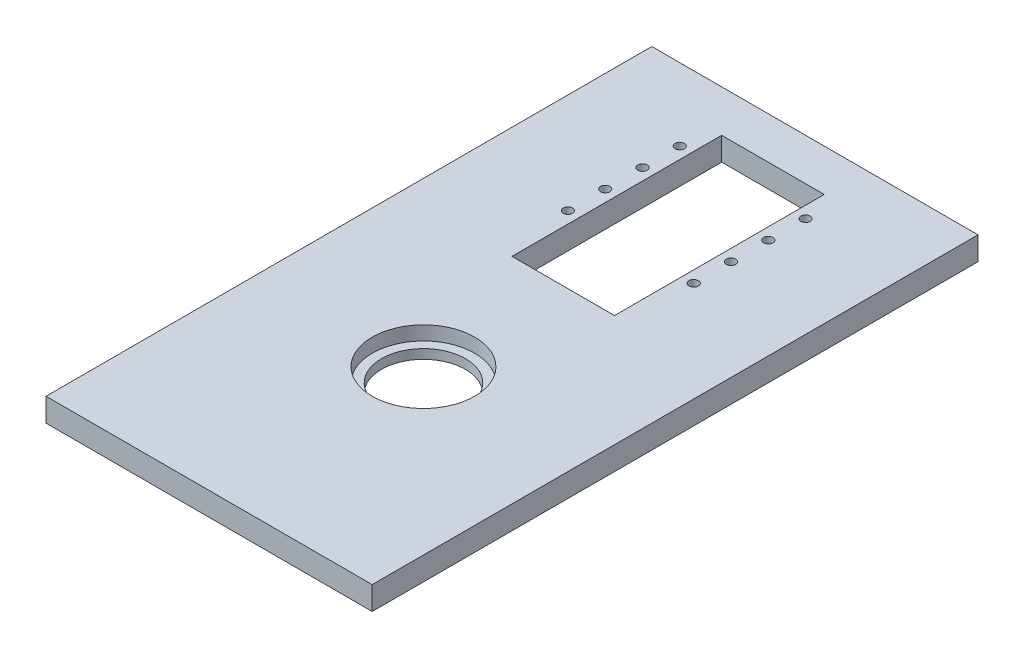
from build123d import *

# Parameters (mm, degrees)
SKETCH3_W           = 70
SKETCH3_H           = 130
SKETCH3_R           = 1
SKETCH3_R_2         = 9
SKETCH3_W_2         = 22
SKETCH3_H_2         = 45
BOSS_EXTRUDE1_DEPTH = 5
SKETCH4_R           = 11
CUT_EXTRUDE3_DEPTH  = 3


with BuildPart() as part:
    # Sketch3 → Boss-Extrude1 (new body)
    with BuildSketch(Plane(origin=(0, 0, 0), x_dir=(1, 0, 0), z_dir=(0, 1, 0))):
        with Locations((0, 19)):
            Rectangle(SKETCH3_W, SKETCH3_H)
        with Locations((-13.5, 60.5)):
            Circle(SKETCH3_R, mode=Mode.SUBTRACT)
        with Locations((13.5, 60.5)):
            Circle(SKETCH3_R, mode=Mode.SUBTRACT)
        with Locations((-13.5, 52.5)):
            Circle(SKETCH3_R, mode=Mode.SUBTRACT)
        with Locations((-13.5, 44.5)):
            Circle(SKETCH3_R, mode=Mode.SUBTRACT)
        with Locations((13.5, 52.5)):
            Circle(SKETCH3_R, mode=Mode.SUBTRACT)
        with Locations((13.5, 44.5)):
            Circle(SKETCH3_R, mode=Mode.SUBTRACT)
        with Locations((-13.5, 68.5)):
            Circle(SKETCH3_R, mode=Mode.SUBTRACT)
        with Locations((13.5, 68.5)):
            Circle(SKETCH3_R, mode=Mode.SUBTRACT)
        Circle(SKETCH3_R_2, mode=Mode.SUBTRACT)
        with Locations((0, 52.5)):
            Rectangle(SKETCH3_W_2, SKETCH3_H_2, mode=Mode.SUBTRACT)
    extrude(amount=BOSS_EXTRUDE1_DEPTH)

    # Sketch4 → Cut-Extrude3 (cut)
    with BuildSketch(Plane(origin=(0, 5, 0), x_dir=(1, 0, 0), z_dir=(0, 1, 0))):
        Circle(SKETCH4_R)
    extrude(amount=-CUT_EXTRUDE3_DEPTH, mode=Mode.SUBTRACT)


solid = part.part
